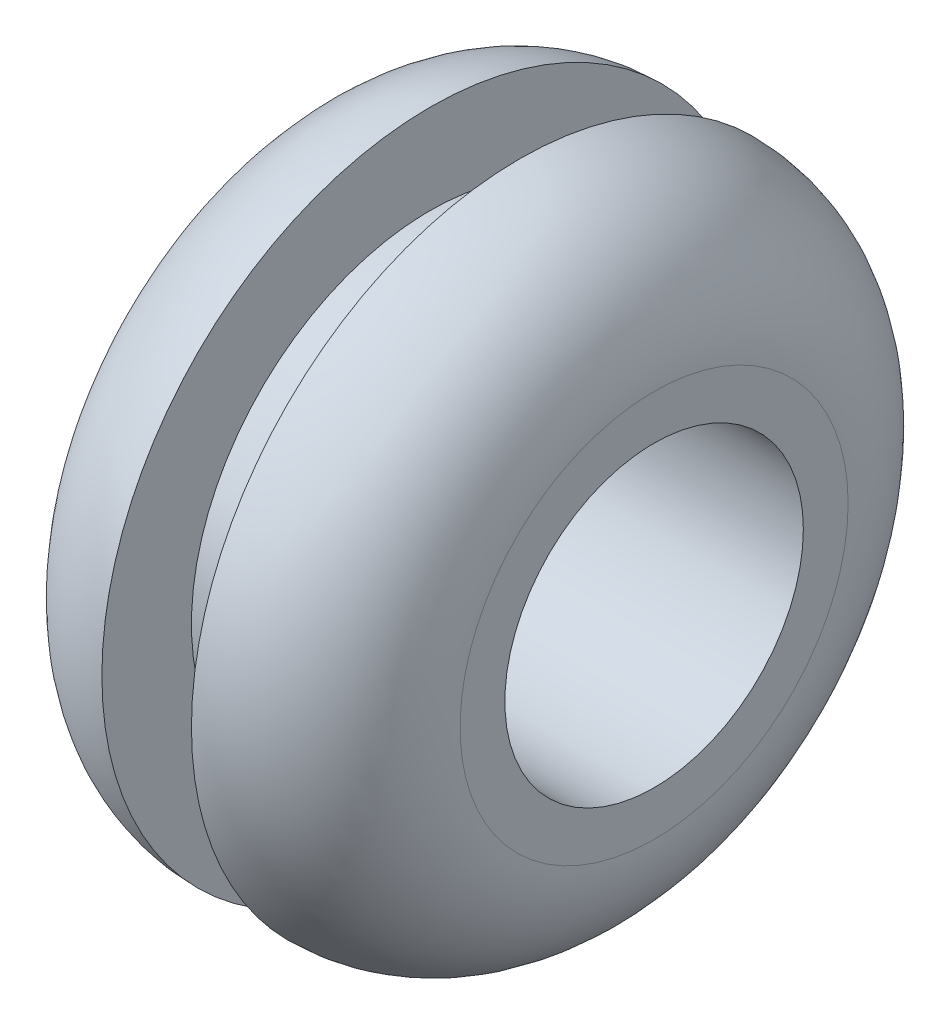
from build123d import *

# Parameters (mm, degrees)
CONG_1_R = 2.25


with BuildPart() as part:
    # Esquisse1 → Révolution1 (revolve)
    with BuildSketch(Plane.XY, mode=Mode.PRIVATE) as r_volution1_sk:
        Polygon((-27.993416317, 2.5), (-21.993416317, 2.5), (-21.993416317, 5.5), (-24.243416317, 5.5), (-24.243416317, 4), (-25.743416317, 4), (-25.743416317, 5.5), (-27.993416317, 5.5), align=None)
    revolve(r_volution1_sk.sketch.rotate(Axis((24.606805167, 0, 0), (-1, 0, 0)), 90), axis=Axis((24.606805167, 0, 0), (-1, 0, 0)))

    # Congé1
    cong_1_edges = [part.edges().sort_by_distance(p)[0] for p in [
        (-27.993416317, 0, 5.5),
        (-21.993416317, 0, 5.5),
    ]]
    fillet(cong_1_edges, radius=CONG_1_R - 0.0001)  # a hair under: the kernel refuses the full size


solid = part.part
